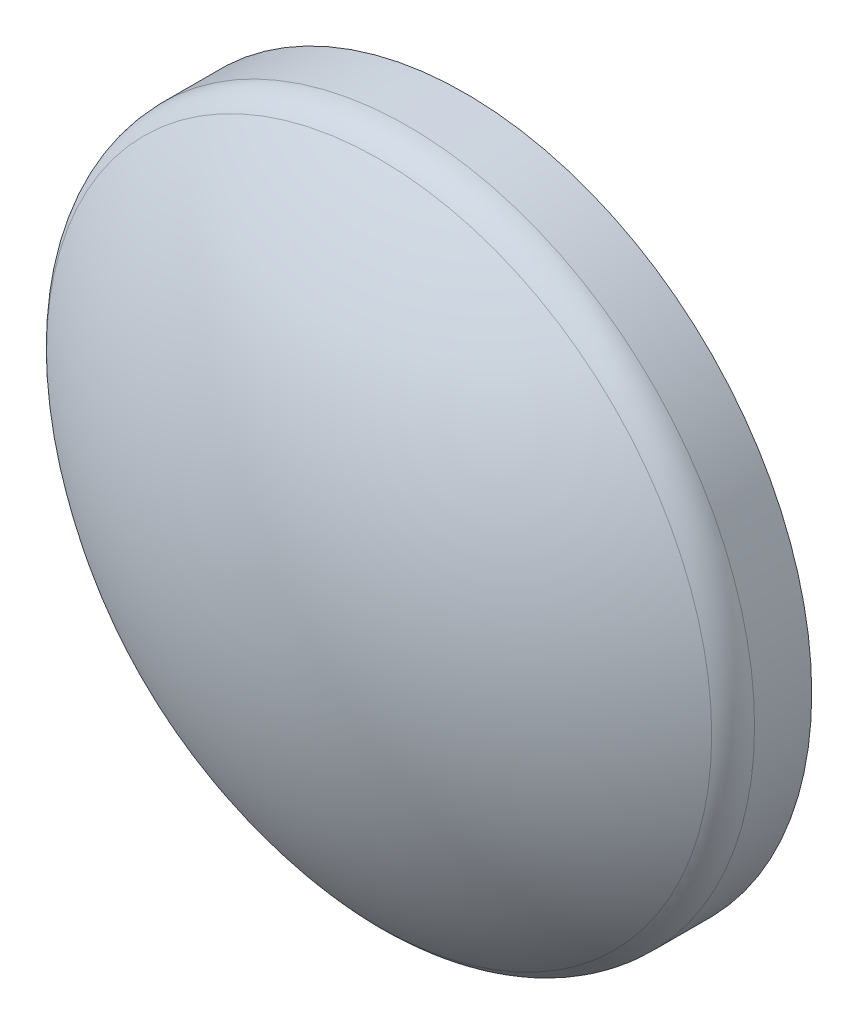
from build123d import *

# Parameters (mm, degrees)
SKETCH1_W = 25.4
SKETCH1_H = 15.875


# Read off the part's stored shape, not the designer's step: Shell1
with BuildPart() as part:
    # Sketch1 → Revolve1 (revolve)
    with BuildSketch(Plane(origin=(0, 0, 0), x_dir=(0, 0, -1), z_dir=(1, 0, 0)), mode=Mode.PRIVATE) as revolve1_sk:
        with Locations((0, 222.9485)):
            Rectangle(SKETCH1_W, SKETCH1_H)
    revolve(revolve1_sk.sketch.rotate(Axis((0, 0, 12.7), (0, 0, -1)), 90), axis=Axis((0, 0, 12.7), (0, 0, -1)))

    # Sketch4 → Revolve2 (revolve)
    with BuildSketch(Plane(origin=(0, 0, 0), x_dir=(0, 0, -1), z_dir=(1, 0, 0)), mode=Mode.PRIVATE) as revolve2_sk:
        with BuildLine():
            Line((-122.282461414, 0), (-12.7, 0))
            Line((-12.7, 0), (-12.7, -230.886))
            Line((-12.7, -230.886), (-25.4, -230.886))
            ThreePointArc((-25.4, -230.886), (-36.113830238, -228.456824301), (-44.732284669, -221.644387428))
            ThreePointArc((-44.732284669, -221.644387428), (-102.666052654, -117.525539589), (-122.282461414, 0))
        make_face()
    revolve(revolve2_sk.sketch.rotate(Axis((0, 0, 12.7), (0, 0, 1)), 90), axis=Axis((0, 0, 12.7), (0, 0, 1)))

    # Shell1 outline → Shell1 (revolve, cut)
    with BuildSketch(Plane.XZ):
        with BuildLine():
            Line((0, 106.407181851), (0, 12.7))
            Line((0, 12.7), (215.011, 12.7))
            Line((215.011, 12.7), (215.011, 25.4))
            ThreePointArc((215.011, 25.4), (214.134214539, 29.267044526), (211.675336982, 32.377785156))
            add(Edge.make_bspline(
                [(211.675336982, 32.377785156), (177.087343464, 60.287410459), (136.762029338, 83.310839183), (92.384997651, 98.992396662), (46.518190979, 106.413340803), (1.62204097, 106.413340464), (1.216369143, 106.412723959), (0.810803831, 106.41149159), (0.405346847, 106.409644001), (0, 106.407181851)],
                knots=[4.712506147, 4.712506147, 4.712506147, 4.712506147, 4.712506147, 4.712506147, 5.391333141, 5.391333141, 5.391333141, 5.391333141, 5.397524414, 5.397524414, 5.397524414, 5.397524414, 5.397524414, 5.397524414], degree=5, weights=[1, 1, 0.998698619, 0.998695907, 1, 1, 1, 1, 1, 1]))
        make_face()
    revolve(axis=Axis((0, 0, 0), (0, 0, 1)), mode=Mode.SUBTRACT)


solid = part.part
